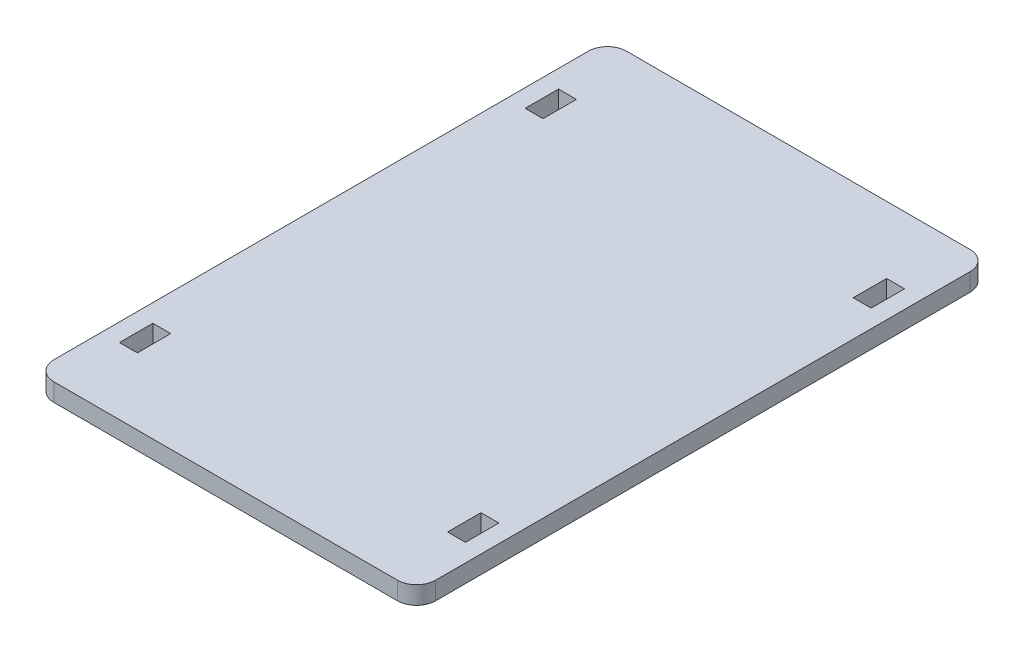
from build123d import *

# Parameters (mm, degrees)
SKETCH1_W           = 101.6
SKETCH1_H           = 152.4
BOSS_EXTRUDE1_DEPTH = 4.7625
SKETCH2_W           = 4.7625
SKETCH2_H           = 8.89
CUT_EXTRUDE1_DEPTH  = 6.35
FILLET1_R           = 5.08


with BuildPart() as part:
    # Sketch1 → Boss-Extrude1 (new body)
    with BuildSketch(Plane(origin=(0, 0, 0), x_dir=(1, 0, 0), z_dir=(0, 1, 0))):
        with Locations((-50.8, 76.2)):
            Rectangle(SKETCH1_W, SKETCH1_H)
    extrude(amount=BOSS_EXTRUDE1_DEPTH)

    # Sketch2 → Cut-Extrude1 (cut)
    with BuildSketch(Plane(origin=(0, 4.7625, 0), x_dir=(1, 0, 0), z_dir=(0, 1, 0))):
        with Locations((-7.14375, 130.175)):
            Rectangle(SKETCH2_W, SKETCH2_H)
        with Locations((-94.45625, 130.175)):
            Rectangle(SKETCH2_W, SKETCH2_H)
        with Locations((-7.14375, 22.225)):
            Rectangle(SKETCH2_W, SKETCH2_H)
        with Locations((-94.45625, 22.225)):
            Rectangle(SKETCH2_W, SKETCH2_H)
    extrude(amount=-CUT_EXTRUDE1_DEPTH, mode=Mode.SUBTRACT)

    # Fillet1
    fillet1_edges = [part.edges().sort_by_distance(p)[0] for p in [
        (-101.6, 2.38125, 0),
        (-101.6, 2.38125, -152.4),
        (0, 2.38125, -152.4),
        (0, 2.38125, 0),
    ]]
    fillet(fillet1_edges, radius=FILLET1_R)


solid = part.part
